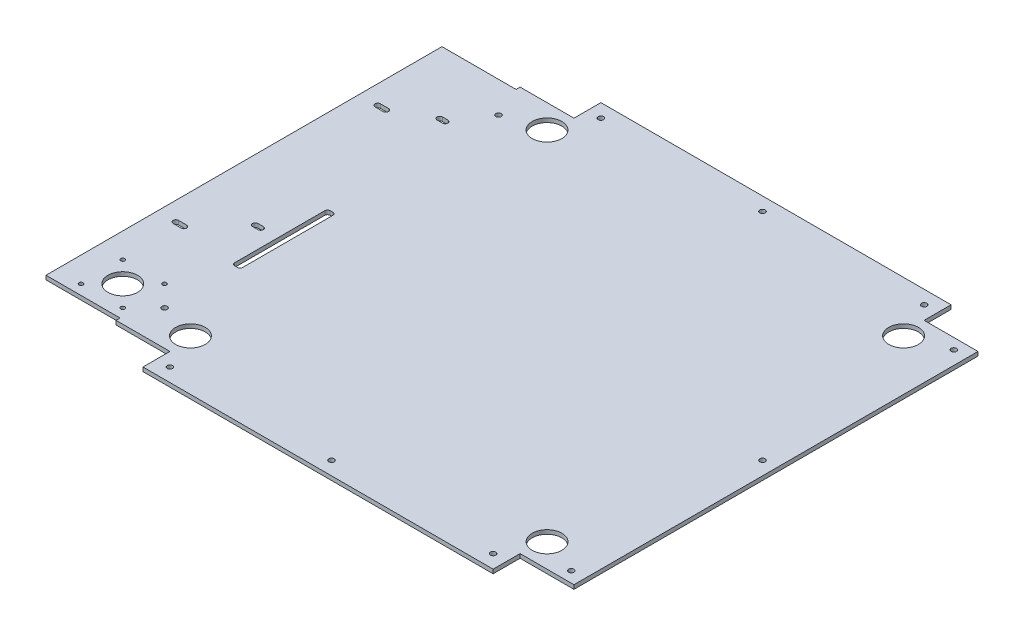
from build123d import *

# Parameters (mm, degrees)
SKETCH1_8_R         = 11
SKETCH1_8_R_2       = 2
SKETCH1_8_R_3       = 1.5
BOSS_EXTRUDE5_DEPTH = 3


with BuildPart() as part:
    # Sketch1<8> → Boss-Extrude5 (new body)
    with BuildSketch(Plane(origin=(0, 0, 0), x_dir=(1, 0, 0), z_dir=(0, 1, 0))):
        Polygon((130, -150), (170, -150), (170, 150), (130, 150), (130, 170), (-130, 170), (-130, 150), (-170, 150), (-170, 147), (-225, 147), (-225, -147), (-170, -147), (-170, -150), (-130, -150), (-130, -170), (130, -170), align=None)
        with Locations((132.375, -132.375)):
            Circle(SKETCH1_8_R, mode=Mode.SUBTRACT)
        with Locations((132.375, 132.375)):
            Circle(SKETCH1_8_R, mode=Mode.SUBTRACT)
        with Locations((160, -142)):
            Circle(SKETCH1_8_R_2, mode=Mode.SUBTRACT)
        with Locations((160, 0)):
            Circle(SKETCH1_8_R_2, mode=Mode.SUBTRACT)
        with Locations((160, 142)):
            Circle(SKETCH1_8_R_2, mode=Mode.SUBTRACT)
        with Locations((-132.375, 132.375)):
            Circle(SKETCH1_8_R, mode=Mode.SUBTRACT)
        with BuildLine():
            ThreePointArc((-163, -2), (-162.414213562, -0.585786438), (-161, 0))
            Line((-161, 0), (-159, 0))
            ThreePointArc((-159, 0), (-157.585786438, -0.585786438), (-157, -2))
            Line((-157, -2), (-157, -68.911348687))
            ThreePointArc((-157, -68.911348687), (-157.585786438, -70.325562249), (-159, -70.911348687))
            Line((-159, -70.911348687), (-161, -70.911348687))
            ThreePointArc((-161, -70.911348687), (-162.414213562, -70.325562249), (-163, -68.911348687))
            Line((-163, -68.911348687), (-163, -2))
        make_face(mode=Mode.SUBTRACT)
        with Locations((-160, 124)):
            Circle(SKETCH1_8_R_2, mode=Mode.SUBTRACT)
        with Locations((-132.375, -132.375)):
            Circle(SKETCH1_8_R, mode=Mode.SUBTRACT)
        with Locations((-160, -124)):
            Circle(SKETCH1_8_R_2, mode=Mode.SUBTRACT)
        with Locations((0, -160)):
            Circle(SKETCH1_8_R_2, mode=Mode.SUBTRACT)
        with Locations((120, -160)):
            Circle(SKETCH1_8_R_2, mode=Mode.SUBTRACT)
        with Locations((-120, -160)):
            Circle(SKETCH1_8_R_2, mode=Mode.SUBTRACT)
        with Locations((-175.5, -108.5)):
            Circle(SKETCH1_8_R_3, mode=Mode.SUBTRACT)
        with Locations((-206.5, -139.5)):
            Circle(SKETCH1_8_R_3, mode=Mode.SUBTRACT)
        with Locations((-175.5, -139.5)):
            Circle(SKETCH1_8_R_3, mode=Mode.SUBTRACT)
        with Locations((-191, -124)):
            Circle(SKETCH1_8_R, mode=Mode.SUBTRACT)
        with Locations((-206.5, -108.5)):
            Circle(SKETCH1_8_R_3, mode=Mode.SUBTRACT)
        with BuildLine():
            ThreePointArc((-211.1, -66.5), (-213.1, -64.5), (-211.1, -62.5))
            Line((-211.1, -62.5), (-205.1, -62.5))
            ThreePointArc((-205.1, -62.5), (-203.1, -64.5), (-205.1, -66.5))
            Line((-205.1, -66.5), (-211.1, -66.5))
        make_face(mode=Mode.SUBTRACT)
        with BuildLine():
            ThreePointArc((-179.6, -39), (-181.6, -37), (-179.6, -35))
            Line((-179.6, -35), (-175.6, -35))
            ThreePointArc((-175.6, -35), (-173.6, -37), (-175.6, -39))
            Line((-175.6, -39), (-179.6, -39))
        make_face(mode=Mode.SUBTRACT)
        with BuildLine():
            ThreePointArc((-211.1, 83.4), (-213.1, 85.4), (-211.1, 87.4))
            Line((-211.1, 87.4), (-205.1, 87.4))
            ThreePointArc((-205.1, 87.4), (-203.1, 85.4), (-205.1, 83.4))
            Line((-205.1, 83.4), (-211.1, 83.4))
        make_face(mode=Mode.SUBTRACT)
        with BuildLine():
            ThreePointArc((-179.6, 98), (-181.6, 100), (-179.6, 102))
            Line((-179.6, 102), (-175.6, 102))
            ThreePointArc((-175.6, 102), (-173.6, 100), (-175.6, 98))
            Line((-175.6, 98), (-179.6, 98))
        make_face(mode=Mode.SUBTRACT)
        with Locations((0, 160)):
            Circle(SKETCH1_8_R_2, mode=Mode.SUBTRACT)
        with Locations((120, 160)):
            Circle(SKETCH1_8_R_2, mode=Mode.SUBTRACT)
        with Locations((-120, 160)):
            Circle(SKETCH1_8_R_2, mode=Mode.SUBTRACT)
    extrude(amount=BOSS_EXTRUDE5_DEPTH)


solid = part.part
